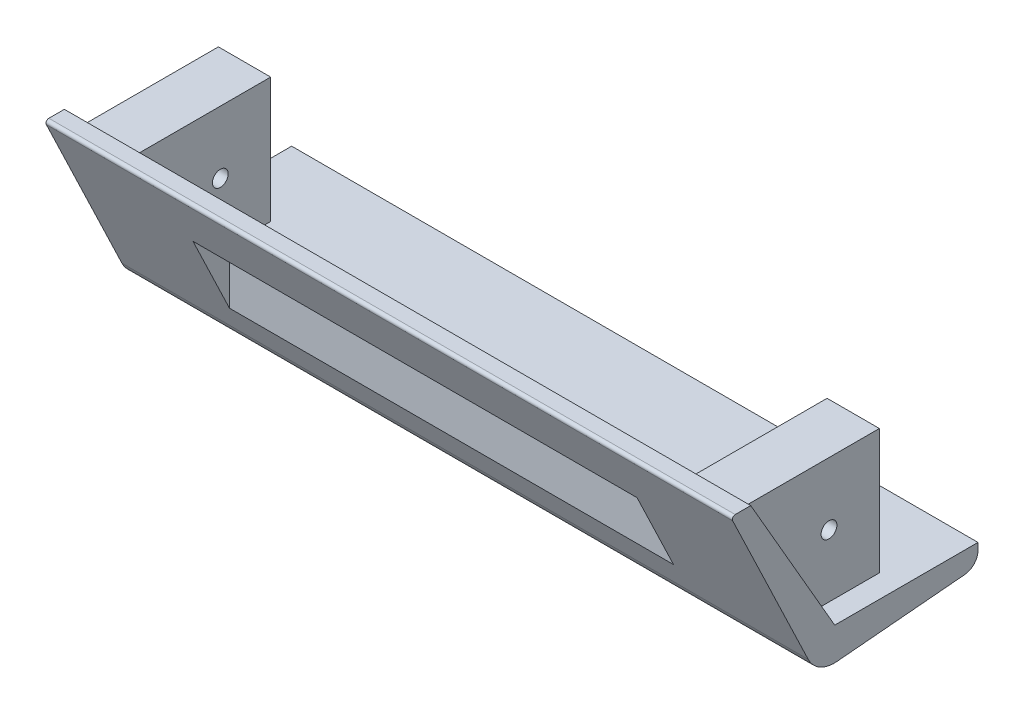
from build123d import *

# Parameters (mm, degrees)
BOSS_EXTRUDE2_DEPTH             = 119.775
BOSS_EXTRUDE1_REACH             = 141.38
SKETCH2_W                       = 18.25
SKETCH2_H                       = 43.65
BOSS_EXTRUDE1_DIRECTION_2_DEPTH = 20
CUT_EXTRUDE2_DEPTH              = 77.5
FILLET1_R                       = 10
FILLET2_R                       = 5
FILLET3_R                       = 1
M5_CLEARANCE_HOLE1_D            = 5.5
CUT_EXTRUDE3_DEPTH              = 10


with BuildPart() as part:
    # Sketch1 → Boss-Extrude2 (new, symmetric)
    with BuildSketch(Plane(origin=(0, 0, 0), x_dir=(0, 0, -1), z_dir=(1, 0, 0))):
        Polygon((0, 0), (-29.329393675, 50.8), (-36.329393675, 50.8), (-6.252899132, -12), (50, -7), (50, 0), align=None)
    extrude(amount=BOSS_EXTRUDE2_DEPTH, both=True)

    # Boss-Extrude1: up to this plane
    boss_extrude1_end = Plane(origin=(119.775, 0, 0), z_dir=(0, -0.5000000000000043, 0.8660254037844362))
    # Sketch2 → Boss-Extrude1 (add, up to the surface)
    with BuildSketch(Plane.XY, mode=Mode.PRIVATE) as boss_extrude1_sk1:
        with Locations((106.225, 25.4)):
            Rectangle(SKETCH2_W, SKETCH2_H)
    boss_extrude1_tool1 = split(extrude(boss_extrude1_sk1.sketch, amount=BOSS_EXTRUDE1_REACH, mode=Mode.PRIVATE), bisect_by=boss_extrude1_end, keep=Keep.BOTH, mode=Mode.PRIVATE)
    add(boss_extrude1_tool1.solids().sort_by_distance((106.225, 25.4, 0))[0])
    # Sketch2 → Boss-Extrude1 (add, up to the surface)
    with BuildSketch(Plane.XY, mode=Mode.PRIVATE) as boss_extrude1_sk2:
        with Locations((-106.225, 25.4)):
            Rectangle(SKETCH2_W, SKETCH2_H)
    boss_extrude1_tool2 = split(extrude(boss_extrude1_sk2.sketch, amount=BOSS_EXTRUDE1_REACH, mode=Mode.PRIVATE), bisect_by=boss_extrude1_end, keep=Keep.BOTH, mode=Mode.PRIVATE)
    add(boss_extrude1_tool2.solids().sort_by_distance((-106.225, 25.4, 0))[0])

    # Sketch2 → Boss-Extrude1 direction 2 (add)
    with BuildSketch(Plane.XY):
        with Locations((106.225, 25.4)):
            Rectangle(SKETCH2_W, SKETCH2_H)
        with Locations((-106.225, 25.4)):
            Rectangle(SKETCH2_W, SKETCH2_H)
    extrude(amount=-BOSS_EXTRUDE1_DIRECTION_2_DEPTH)

    # Sketch4 → Cut-Extrude2 (cut, symmetric)
    with BuildSketch(Plane(origin=(0, 0, 0), x_dir=(0, 0, -1), z_dir=(1, 0, 0))):
        Polygon((-26.729651832, 30.755649855), (-20, 34.641016151), (-14, 24.248711306), (-14, 4.176018579), align=None)
    extrude(amount=CUT_EXTRUDE2_DEPTH, both=True, mode=Mode.SUBTRACT)

    # Fillet1
    fillet1_edges = [part.edges().sort_by_distance(p)[0] for p in [
        (0, -12, 6.252899132),
    ]]
    fillet(fillet1_edges, radius=FILLET1_R)

    # Fillet2
    fillet2_edges = [part.edges().sort_by_distance(p)[0] for p in [
        (0, -7, -50),
    ]]
    fillet(fillet2_edges, radius=FILLET2_R)

    # Fillet3
    fillet3_edges = [part.edges().sort_by_distance(p)[0] for p in [
        (0, 50.8, 36.329393675),
    ]]
    fillet(fillet3_edges, radius=FILLET3_R)

    # M5 Clearance Hole1 (through all)
    with Locations(Plane(origin=(115.35, 0, 0), x_dir=(0, 0, -1), z_dir=(1, 0, 0))):
        with Locations((2.420606325, 25.4)):
            Hole(M5_CLEARANCE_HOLE1_D / 2)

    # Sketch8 → Cut-Extrude3 (cut)
    with BuildSketch(Plane.ZY.offset(-77.5)):
        with BuildLine():
            Line((20, 34.641016151), (22.598076211, 33.141016151))
            Line((22.598076211, 33.141016151), (17.598076211, 24.480762114))
            ThreePointArc((17.598076211, 24.480762114), (16.383663494, 23.548910461), (14.866025404, 23.748711306))
            Line((14.866025404, 23.748711306), (14, 24.248711306))
            Line((14, 24.248711306), (20, 34.641016151))
        make_face()
    extrude(amount=-CUT_EXTRUDE3_DEPTH, mode=Mode.SUBTRACT)


solid = part.part
